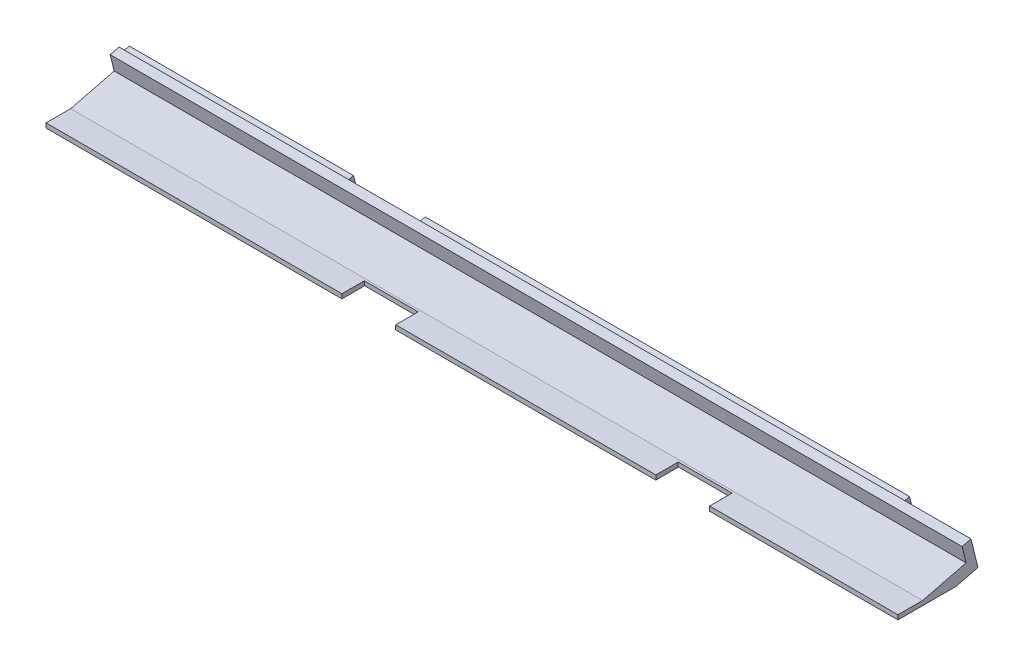
from build123d import *

# Parameters (mm, degrees)
PROFILE_DEPTH      = 190
SKETCH2_W          = 186
SKETCH2_H          = 2
AIR_INLET_DEPTH    = 192.009693193
BOTTOM_TAB_CUTS_W  = 12
BOTTOM_TAB_CUTS_H  = 5
BOTTOM_TABS_DEPTH  = 14
SKETCH5_W          = 16
SKETCH5_H          = 2
CUT_EXTRUDE3_DEPTH = 14


with BuildPart() as part:
    # Sketch1 → Profile (new body)
    with BuildSketch(Plane(origin=(0, 0, 0), x_dir=(0, 0, -1), z_dir=(1, 0, 0))):
        Polygon((0, 0), (13, 0), (19.792070084, 1.693453269), (18.582460606, 6.544931901), (16.641869153, 6.061088109), (16.27898631, 7.516531699), (14.30414725, 7.02414902), (15.202957263, 3.419218956), (5.5, 1), (0, 1), align=None)
    extrude(amount=PROFILE_DEPTH)

    # Sketch2 → Air inlet (cut, through all)
    with BuildSketch(Plane(origin=(0, 4.745018427, -19.031229438), x_dir=(-1, 0, 0), z_dir=(0, 0.2419218955996687, -0.9702957262759964))):
        with Locations((-95, -2.144984643)):
            Rectangle(SKETCH2_W, SKETCH2_H)
    extrude(amount=-AIR_INLET_DEPTH, mode=Mode.SUBTRACT)

    # Bottom tab cuts → Bottom tabs (cut)
    with BuildSketch(Plane(origin=(0, 1, 0), x_dir=(1, 0, 0), z_dir=(0, 1, 0))):
        with Locations((142, 2.5)):
            Rectangle(BOTTOM_TAB_CUTS_W, BOTTOM_TAB_CUTS_H)
        with Locations((72, 2.5)):
            Rectangle(BOTTOM_TAB_CUTS_W, BOTTOM_TAB_CUTS_H)
    extrude(amount=-BOTTOM_TABS_DEPTH, mode=Mode.SUBTRACT)

    # Sketch5 → Cut-Extrude3 (cut)
    with BuildSketch(Plane(origin=(0, 1.799913473, 0.448768832), x_dir=(1, 0, 0), z_dir=(0, 0.970295726275996, 0.24192189559966923))):
        with Locations((182, 18.613844442)):
            Rectangle(SKETCH5_W, SKETCH5_H)
        with Locations((58, 18.613844442)):
            Rectangle(SKETCH5_W, SKETCH5_H)
    extrude(amount=-CUT_EXTRUDE3_DEPTH, mode=Mode.SUBTRACT)


solid = part.part
